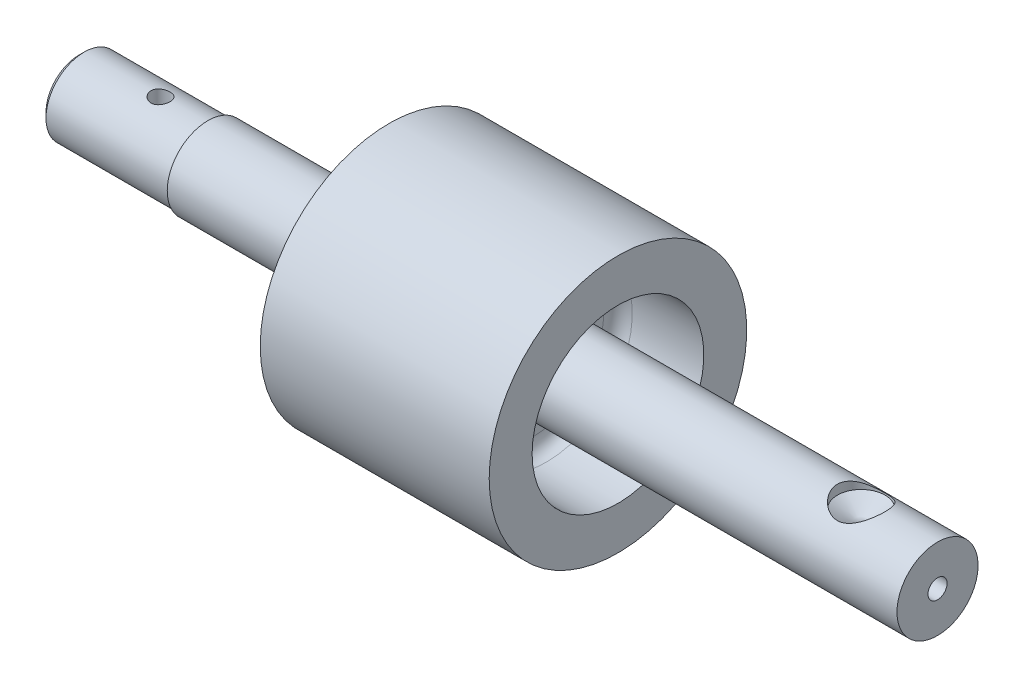
from build123d import *

# Parameters (mm, degrees)
FILLET_4_R       = 3
F_4_0MM_4_D      = 4
F_4_0MM_4_DEPTH  = 8
F_4_0MM_4_TIP    = 1.201721238
F_4_0MM_5_D      = 4
F_4_0MM_5_DEPTH  = 7
F_4_0MM_5_TIP    = 1.201721238
F_10_0MM_1_D     = 10
F_10_0MM_1_DEPTH = 1.995696905
F_10_0MM_1_TIP   = 3.004303095


# Read off the part's stored shape, not the designer's step: M16 机械螺纹 螺柱1
with BuildPart() as part:
    # 草图1 → 旋转1 (revolve)
    with BuildSketch(Plane.XY, mode=Mode.PRIVATE) as revolve_1_sk:
        Polygon((0, 0), (0, 8), (27, 8), (27, 8.5), (83, 8.5), (83, 18), (65, 18), (65, 27), (113, 27), (113, 18), (95, 18), (95, 8.5), (180, 8.5), (180, 0), align=None)
    revolve(revolve_1_sk.sketch.rotate(Axis((0, 0, 0), (1, 0, 0)), 90), axis=Axis((0, 0, 0), (1, 0, 0)))

    # 圆角4
    fillet_4_edges = [part.edges().sort_by_distance(p)[0] for p in [
        (95, 0, -8.5),
        (95, 0, -18),
        (83, 0, -18),
        (83, 0, -8.5),
    ]]
    fillet(fillet_4_edges, radius=FILLET_4_R)

    # M16 机械螺纹 螺柱1 outline → M16 机械螺纹 螺柱1 (revolve, cut)
    with BuildSketch(Plane.YX):
        Polygon((8, 1.0825), (6.9175, 0), (8, 0), align=None)
    revolve(axis=Axis((0, 0, 0), (1, 0, 0)), mode=Mode.SUBTRACT)

    # Ø4.0mm 暗销孔4
    with Locations(Plane(origin=(17.1, 8, 0), x_dir=(0, 0, 1), z_dir=(0, 1, 0))):
        with Locations((0, 0)):
            Hole(F_4_0MM_4_D / 2, depth=F_4_0MM_4_DEPTH)
            with Locations((0, 0, -(F_4_0MM_4_DEPTH + F_4_0MM_4_TIP / 2))):  # 118° drill point
                Cone(0, F_4_0MM_4_D / 2, F_4_0MM_4_TIP, mode=Mode.SUBTRACT)

    # Ø4.0mm 暗销孔5
    with Locations(Plane(origin=(180, 0, 0), x_dir=(0, 0, -1), z_dir=(1, 0, 0))):
        with Locations((0, 0)):
            Hole(F_4_0MM_5_D / 2, depth=F_4_0MM_5_DEPTH)
            with Locations((0, 0, -(F_4_0MM_5_DEPTH + F_4_0MM_5_TIP / 2))):  # 118° drill point
                Cone(0, F_4_0MM_5_D / 2, F_4_0MM_5_TIP, mode=Mode.SUBTRACT)

    # Ø10.0mm 暗销孔1
    with Locations(Plane(origin=(164, 8.5, 0), x_dir=(0, 0, 1), z_dir=(0, 1, 0))):
        with Locations((0, 0)):
            Hole(F_10_0MM_1_D / 2, depth=F_10_0MM_1_DEPTH)
            with Locations((0, 0, -(F_10_0MM_1_DEPTH + F_10_0MM_1_TIP / 2))):  # 118° drill point
                Cone(0, F_10_0MM_1_D / 2, F_10_0MM_1_TIP, mode=Mode.SUBTRACT)


solid = part.part
